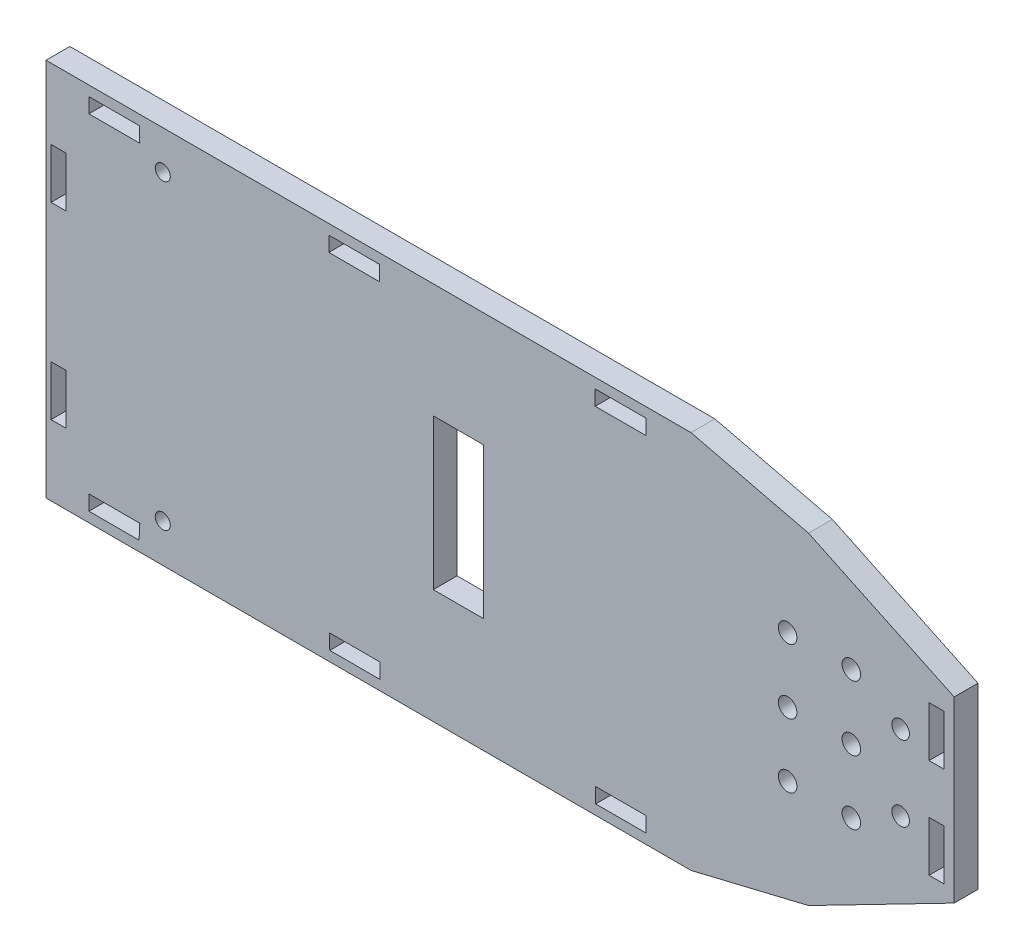
from build123d import *

# Parameters (mm, degrees)
SKETCH1_W           = 181
SKETCH1_H           = 75.57
BOSS_EXTRUDE2_DEPTH = 4.75
SKETCH6_W           = 3
SKETCH6_H           = 10
SKETCH6_W_2         = 10.095812656
SKETCH6_H_2         = 3.003442242
SKETCH6_W_3         = 10
SKETCH6_H_3         = 30
SKETCH6_R           = 1.5
SKETCH6_R_2         = 1.85
SKETCH6_R_3         = 1.75
CUT_EXTRUDE7_DEPTH  = 9


with BuildPart() as part:
    # Sketch1 → Boss-Extrude2 (new body)
    with BuildSketch(Plane.XY):
        Rectangle(SKETCH1_W, SKETCH1_H)
    extrude(amount=BOSS_EXTRUDE2_DEPTH)

    # Sketch6 → Cut-Extrude7 (cut)
    with BuildSketch(Plane.XY.offset(4.75)):
        Polygon((-81.955185068, 35.785), (-81.955183992, 32.802018857), (-71.81277502, 32.798644215), (-71.859372412, 35.785), align=None)
        with Locations((-88, 18.75)):
            Rectangle(SKETCH6_W, SKETCH6_H)
        with Locations((-88, -18.75)):
            Rectangle(SKETCH6_W, SKETCH6_H)
        Polygon((-34.13878131, 35.785), (-34.130786214, 32.798291399), (-24.042968654, 32.781557758), (-24.042968654, 35.785), align=None)
        Polygon((-71.81277502, -32.788413815), (-81.955183992, -32.785039173), (-81.955181828, -35.785039173), (-71.955181828, -35.785031959), align=None)
        Polygon((-33.95518398, -32.801010013), (-33.947153334, -35.800999264), (-23.947156396, -35.808824865), (-23.946905936, -32.804340026), align=None)
        with Locations((87, 9.9)):
            Rectangle(SKETCH6_W, SKETCH6_H)
        with Locations((24.004937674, 34.283278879)):
            Rectangle(SKETCH6_W_2, SKETCH6_H_2)
        Polygon((29.052844002, -32.806257253), (19.053094123, -32.805423656), (19.052844037, -35.805423646), (29.052844002, -35.806257264), align=None)
        with Locations((-8.31156853, 0)):
            Rectangle(SKETCH6_W_3, SKETCH6_H_3)
        with Locations((87, -9.9)):
            Rectangle(SKETCH6_W, SKETCH6_H)
        Polygon((61.46627389, 32.14), (90.5, 18.385572572), (90.5, 37.785), (38.055212144, 37.785), align=None)
        Polygon((61.466273892, -32.14), (38.055212144, -37.785), (90.5, -37.785), (90.5, -17.2), align=None)
        with Locations((-67.23, 30.095)):
            Circle(SKETCH6_R)
        with Locations((-67.23, -30.095)):
            Circle(SKETCH6_R)
        with Locations((70.00651733, -12.753407437)):
            Circle(SKETCH6_R_2)
        with Locations((70.00651733, 12.892480558)):
            Circle(SKETCH6_R_2)
        with Locations((70.00651733, 0)):
            Circle(SKETCH6_R_2)
        with Locations((57.30651733, 12.892480558)):
            Circle(SKETCH6_R_2)
        with Locations((57.30651733, 0)):
            Circle(SKETCH6_R_2)
        with Locations((57.30651733, -12.753407437)):
            Circle(SKETCH6_R_2)
        with Locations((79.833359723, -7.5)):
            Circle(SKETCH6_R_3)
        with Locations((79.833359723, 7.5)):
            Circle(SKETCH6_R_3)
    extrude(amount=-CUT_EXTRUDE7_DEPTH, mode=Mode.SUBTRACT)


solid = part.part
